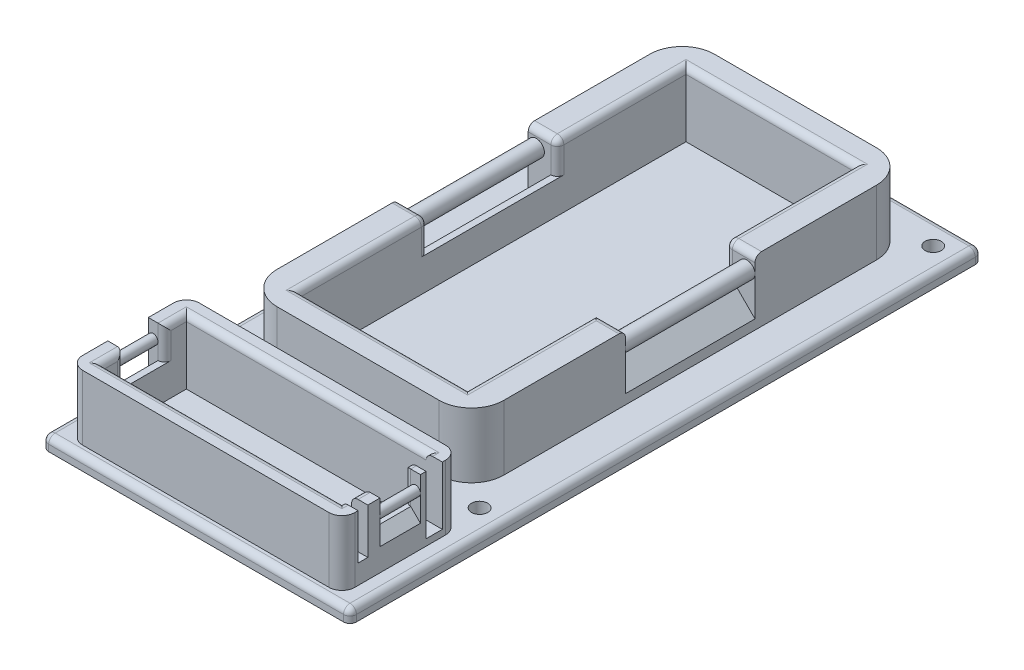
from build123d import *

# Parameters (mm, degrees)
SKETCH1_R           = 3.175
BOSS_EXTRUDE1_DEPTH = 5.08
SKETCH2_W           = 66.04
SKETCH2_H           = 151.638
BOSS_EXTRUDE2_DEPTH = 25.4
SKETCH3_W           = 50.8
SKETCH3_H           = 12.7
CUT_EXTRUDE1_DEPTH  = 76.2
BOSS_EXTRUDE3_REACH = 143.07
SKETCH4_R           = 3.175
SKETCH6_W           = 106.68
SKETCH6_H           = 45.72
SKETCH6_W_2         = 93.98
SKETCH6_H_2         = 33.02
BOSS_EXTRUDE4_DEPTH = 25.4
SKETCH8_W           = 6.35
SKETCH8_H           = 15.875
CUT_EXTRUDE2_DEPTH  = 12.7
SKETCH10_R          = 1.905
BOSS_EXTRUDE5_DEPTH = 15.875
FILLET6_R           = 2.54
FILLET7_R           = 2.54
FILLET8_R           = 2.54
FILLET9_R           = 5.08
CHAMFER2_SIZE       = 8.89
FILLET10_R          = 2.54
FILLET5_R           = 2.54
CHAMFER3_SIZE       = 8.89
CHAMFER5_SIZE       = 3.81
CHAMFER6_SIZE       = 3.81
CUT_EXTRUDE3_START  = 2.54
SKETCH12_W          = 6.35
SKETCH12_H          = 6.35
CUT_EXTRUDE3_DEPTH  = 161.408968239
CUT_EXTRUDE4_START  = 7.62
SKETCH13_W          = 6.35
SKETCH13_H          = 3.81
CUT_EXTRUDE4_DEPTH  = 156.328968239


# Some blends are built 0.0001 mm under size
with BuildPart() as part:
    # Sketch1 → Boss-Extrude1 (new body)
    with BuildSketch(Plane(origin=(0, 0, 0), x_dir=(1, 0, 0), z_dir=(0, 1, 0))):
        Polygon((-60.325, -98.425), (-60.325, -149.225), (60.325, -149.225), (60.325, -98.425), (60.325, 98.425), (-60.325, 98.425), align=None)
        with Locations(Location((-50.8, 88.9, 0), (0, 0, 270))):
            Circle(SKETCH1_R, mode=Mode.SUBTRACT)
        with Locations(Location((50.8, 88.9, 0), (0, 0, 270))):
            Circle(SKETCH1_R, mode=Mode.SUBTRACT)
        with Locations(Location((50.8, -88.9, 0), (0, 0, 270))):
            Circle(SKETCH1_R, mode=Mode.SUBTRACT)
        with Locations(Location((-50.8, -88.9, 0), (0, 0, 270))):
            Circle(SKETCH1_R, mode=Mode.SUBTRACT)
    extrude(amount=BOSS_EXTRUDE1_DEPTH)

    # Sketch2 → Boss-Extrude2 (add)
    with BuildSketch(Plane(origin=(0, 5.08, 0), x_dir=(1, 0, 0), z_dir=(0, 1, 0))):
        with BuildLine():
            Line((31.75, -85.725), (-31.75, -85.725))
            ThreePointArc((-31.75, -85.725), (-40.730256121, -82.005256121), (-44.45, -73.025))
            Line((-44.45, -73.025), (-44.45, 73.025))
            ThreePointArc((-44.45, 73.025), (-40.730256121, 82.005256121), (-31.75, 85.725))
            Line((-31.75, 85.725), (31.75, 85.725))
            ThreePointArc((31.75, 85.725), (40.730256121, 82.005256121), (44.45, 73.025))
            Line((44.45, 73.025), (44.45, -73.025))
            ThreePointArc((44.45, -73.025), (40.730256121, -82.005256121), (31.75, -85.725))
        make_face()
        Rectangle(SKETCH2_W, SKETCH2_H, mode=Mode.SUBTRACT)
    extrude(amount=BOSS_EXTRUDE2_DEPTH)

    # Sketch3 → Cut-Extrude1 (cut, symmetric)
    with BuildSketch(Plane(origin=(0, 0, 0), x_dir=(0, 0, -1), z_dir=(1, 0, 0))):
        with Locations((0, 24.13)):
            Rectangle(SKETCH3_W, SKETCH3_H)
    extrude(amount=CUT_EXTRUDE1_DEPTH, both=True, mode=Mode.SUBTRACT)

    # Sketch4 → Boss-Extrude3 (add, up to next)
    with BuildSketch(Plane(origin=(0, 0, 25.4), x_dir=(-1, 0, 0), z_dir=(0, 0, -1)), mode=Mode.PRIVATE) as boss_extrude3_sk1:
        with Locations(Location((-41.275, 24.13, 0), (0, 0, 180))):
            Circle(SKETCH4_R)
    boss_extrude3_tool1 = extrude(boss_extrude3_sk1.sketch, amount=BOSS_EXTRUDE3_REACH, mode=Mode.PRIVATE) - part.part
    boss_extrude3 = boss_extrude3_tool1.solids().sort_by_distance((41.275, 24.13, 25.4))[0]
    add(boss_extrude3)

    # Mirror1: Boss-Extrude3 across plane
    add(boss_extrude3.mirror(Plane(origin=(0, 0, 0), x_dir=(0, 0, 1), z_dir=(1, 0, 0))))

    # Sketch6 → Boss-Extrude4 (add)
    with BuildSketch(Plane(origin=(0, 5.08, 0), x_dir=(1, 0, 0), z_dir=(0, 1, 0))):
        with Locations((0, -122.555)):
            Rectangle(SKETCH6_W, SKETCH6_H)
        with Locations((0, -122.555)):
            Rectangle(SKETCH6_W_2, SKETCH6_H_2, mode=Mode.SUBTRACT)
    extrude(amount=BOSS_EXTRUDE4_DEPTH)

    # Sketch8 → Cut-Extrude2 (cut)
    with BuildSketch(Plane(origin=(0, 30.48, 0), x_dir=(1, 0, 0), z_dir=(0, 1, 0))):
        with Locations((50.165, -122.555)):
            Rectangle(SKETCH8_W, SKETCH8_H)
    cut_extrude2 = extrude(amount=-CUT_EXTRUDE2_DEPTH, mode=Mode.SUBTRACT)

    # Sketch10 → Boss-Extrude5 (add)
    with BuildSketch(Plane(origin=(0, 0, 130.4925), x_dir=(-1, 0, 0), z_dir=(0, 0, -1))):
        with Locations(Location((-51.435, 24.13, 0), (0, 0, 180))):
            Circle(SKETCH10_R)
    boss_extrude5 = extrude(amount=BOSS_EXTRUDE5_DEPTH)

    # Mirror2: Cut-Extrude2, Boss-Extrude5 across plane
    add(cut_extrude2.mirror(Plane(origin=(0, 0, 0), x_dir=(0, 0, 1), z_dir=(1, 0, 0))), mode=Mode.SUBTRACT)
    add(boss_extrude5.mirror(Plane(origin=(0, 0, 0), x_dir=(0, 0, 1), z_dir=(1, 0, 0))))

    # Fillet6
    fillet6_edges = [part.edges().sort_by_distance(p)[0] for p in [
        (-46.99, 30.48, 110.33125),
        (0, 30.48, 139.065),
        (46.99, 30.48, 134.77875),
        (0, 30.48, 106.045),
        (46.99, 30.48, 110.33125),
        (46.99, 24.13, 130.4925),
        (46.99, 24.13, 114.6175),
        (-46.99, 30.48, 134.77875),
        (-46.99, 24.13, 114.6175),
        (-46.99, 24.13, 130.4925),
    ]]
    fillet(fillet6_edges, radius=FILLET6_R - 0.0001)  # a hair under: the kernel refuses the full size

    # Fillet7
    fillet7_edges = [part.edges().sort_by_distance(p)[0] for p in [
        (-60.325, 5.08, 25.4),
        (0, 5.08, 149.225),
        (60.325, 5.08, 25.4),
        (0, 5.08, -98.425),
    ]]
    fillet(fillet7_edges, radius=FILLET7_R)

    # Fillet8
    # the kernel refuses this fillet: 2.54 mm, written as the material it takes off along each edge
    with BuildSketch(Plane(origin=(-57.785, 2.54, 146.685), x_dir=(0, 0, 1), z_dir=(-1, 0, 0))) as fillet8_piece_1_section:
        Polygon((0, 0), (FILLET8_R, 0), (FILLET8_R, FILLET8_R), (0, FILLET8_R), align=None)
    fillet8_piece_1 = extrude(amount=FILLET8_R, mode=Mode.PRIVATE)
    fillet8_piece_1 = fillet8_piece_1 - Plane(origin=(-57.785, 2.54, 146.685), x_dir=(0, -0.7071067811865475, -0.7071067811865475), z_dir=(-1, 0, 0)) * Sphere(FILLET8_R, mode=Mode.PRIVATE)
    add(fillet8_piece_1, mode=Mode.SUBTRACT)
    with BuildSketch(Plane(origin=(-57.785, 2.54, -95.885), x_dir=(0, 0, -1), z_dir=(-1, 0, 0))) as fillet8_piece_2_section:
        Polygon((0, 0), (FILLET8_R, 0), (FILLET8_R, -FILLET8_R), (0, -FILLET8_R), align=None)
    fillet8_piece_2 = extrude(amount=FILLET8_R, mode=Mode.PRIVATE)
    fillet8_piece_2 = fillet8_piece_2 - Plane(origin=(-57.785, 2.54, -95.885), x_dir=(0, -0.7071067811865475, 0.7071067811865475), z_dir=(-1, 0, 0)) * Sphere(FILLET8_R, mode=Mode.PRIVATE)
    add(fillet8_piece_2, mode=Mode.SUBTRACT)
    with BuildSketch(Plane(origin=(57.785, 2.54, 146.685), x_dir=(1, 0, 0), z_dir=(0, 0, 1))) as fillet8_piece_3_section:
        Polygon((0, 0), (FILLET8_R, 0), (FILLET8_R, FILLET8_R), (0, FILLET8_R), align=None)
    fillet8_piece_3 = extrude(amount=FILLET8_R, mode=Mode.PRIVATE)
    fillet8_piece_3 = fillet8_piece_3 - Plane(origin=(57.785, 2.54, 146.685), x_dir=(-0.7071067811865475, -0.7071067811865475, 0), z_dir=(0, 0, 1)) * Sphere(FILLET8_R, mode=Mode.PRIVATE)
    add(fillet8_piece_3, mode=Mode.SUBTRACT)
    with BuildSketch(Plane(origin=(57.785, 2.54, -95.885), x_dir=(1, 0, 0), z_dir=(0, 0, -1))) as fillet8_piece_4_section:
        Polygon((0, 0), (FILLET8_R, 0), (FILLET8_R, -FILLET8_R), (0, -FILLET8_R), align=None)
    fillet8_piece_4 = extrude(amount=FILLET8_R, mode=Mode.PRIVATE)
    fillet8_piece_4 = fillet8_piece_4 - Plane(origin=(57.785, 2.54, -95.885), x_dir=(-0.7071067811865475, -0.7071067811865475, 0), z_dir=(0, 0, -1)) * Sphere(FILLET8_R, mode=Mode.PRIVATE)
    add(fillet8_piece_4, mode=Mode.SUBTRACT)
    with BuildSketch(Plane(origin=(60.325, -6.35, -98.425), x_dir=(-1, 0, 0), z_dir=(0, 1, 0)), Plane(origin=(-60.325, -6.35, -98.425), x_dir=(0, 0, 1), z_dir=(0, 1, 0))) as fillet8_piece_5:
        with BuildLine():
            CenterArc((FILLET8_R, FILLET8_R), FILLET8_R, 180, 90)
            Line((0, FILLET8_R), (0, 0))
            Line((0, 0), (FILLET8_R, 0))
        make_face()
    extrude(amount=8.89, mode=Mode.SUBTRACT)
    with BuildSketch(Plane(origin=(60.325, -6.35, 149.225), x_dir=(-1, 0, 0), z_dir=(0, 1, 0)), Plane(origin=(-60.325, -6.35, 149.225), x_dir=(0, 0, -1), z_dir=(0, 1, 0))) as fillet8_piece_6:
        with BuildLine():
            CenterArc((FILLET8_R, -FILLET8_R), FILLET8_R, 90, 90)
            Line((0, -FILLET8_R), (0, 0))
            Line((0, 0), (FILLET8_R, 0))
        make_face()
    extrude(amount=8.89, mode=Mode.SUBTRACT)

    # Fillet9
    fillet9_edges = [part.edges().sort_by_distance(p)[0] for p in [
        (53.34, 17.78, 145.415),
        (53.34, 17.78, 99.695),
        (-53.34, 17.78, 99.695),
        (-53.34, 17.78, 145.415),
    ]]
    fillet(fillet9_edges, radius=FILLET9_R)

    # Chamfer2
    chamfer2_edges = [part.edges().sort_by_distance(p)[0] for p in [
        (-44.45, 17.78, 0),
    ]]
    chamfer(chamfer2_edges, length=CHAMFER2_SIZE)

    # Fillet10
    fillet10_edges = [part.edges().sort_by_distance(p)[0] for p in [
        (-33.02, 24.13, 25.4),
        (-33.02, 24.13, -25.4),
    ]]
    fillet(fillet10_edges, radius=FILLET10_R)

    # Fillet5
    fillet5_edges = [part.edges().sort_by_distance(p)[0] for p in [
        (-33.02, 30.48, 51.8795),
        (-33.763948776, 30.48, 26.143948776),
        (-33.763948776, 30.48, -26.143948776),
        (33.02, 30.48, 50.6095),
        (0, 30.48, -75.819),
        (-33.02, 30.48, -51.8795),
        (0, 30.48, 75.819),
        (33.02, 30.48, -50.6095),
        (38.735, 30.48, 25.4),
        (-40.005, 30.48, 25.4),
        (38.735, 30.48, -25.4),
        (-40.005, 30.48, -25.4),
        (33.02, 24.13, -25.4),
    ]]
    fillet(fillet5_edges, radius=FILLET5_R)

    # Chamfer3
    chamfer3_edges = [part.edges().sort_by_distance(p)[0] for p in [
        (44.45, 17.78, 0),
    ]]
    chamfer(chamfer3_edges, length=CHAMFER3_SIZE)

    # Chamfer5
    chamfer5_edges = [part.edges().sort_by_distance(p)[0] for p in [
        (53.34, 17.78, 122.555),
    ]]
    chamfer(chamfer5_edges, length=CHAMFER5_SIZE)

    # Chamfer6
    chamfer6_edges = [part.edges().sort_by_distance(p)[0] for p in [
        (-53.34, 17.78, 122.555),
    ]]
    chamfer(chamfer6_edges, length=CHAMFER6_SIZE)

    # Sketch12 → Cut-Extrude3 (cut, through all)
    with BuildSketch(Plane(origin=(0, 5.08, 0), x_dir=(1, 0, 0), z_dir=(0, 1, 0)).offset(CUT_EXTRUDE3_START)):
        with Locations((50.165, -109.22)):
            Rectangle(SKETCH12_W, SKETCH12_H)
    extrude(amount=CUT_EXTRUDE3_DEPTH, mode=Mode.SUBTRACT)

    # Sketch13 → Cut-Extrude4 (cut, through all)
    with BuildSketch(Plane(origin=(0, 5.08, 0), x_dir=(1, 0, 0), z_dir=(0, 1, 0)).offset(CUT_EXTRUDE4_START)):
        with Locations((50.165, -137.16)):
            Rectangle(SKETCH13_W, SKETCH13_H)
    extrude(amount=CUT_EXTRUDE4_DEPTH, mode=Mode.SUBTRACT)


solid = part.part
